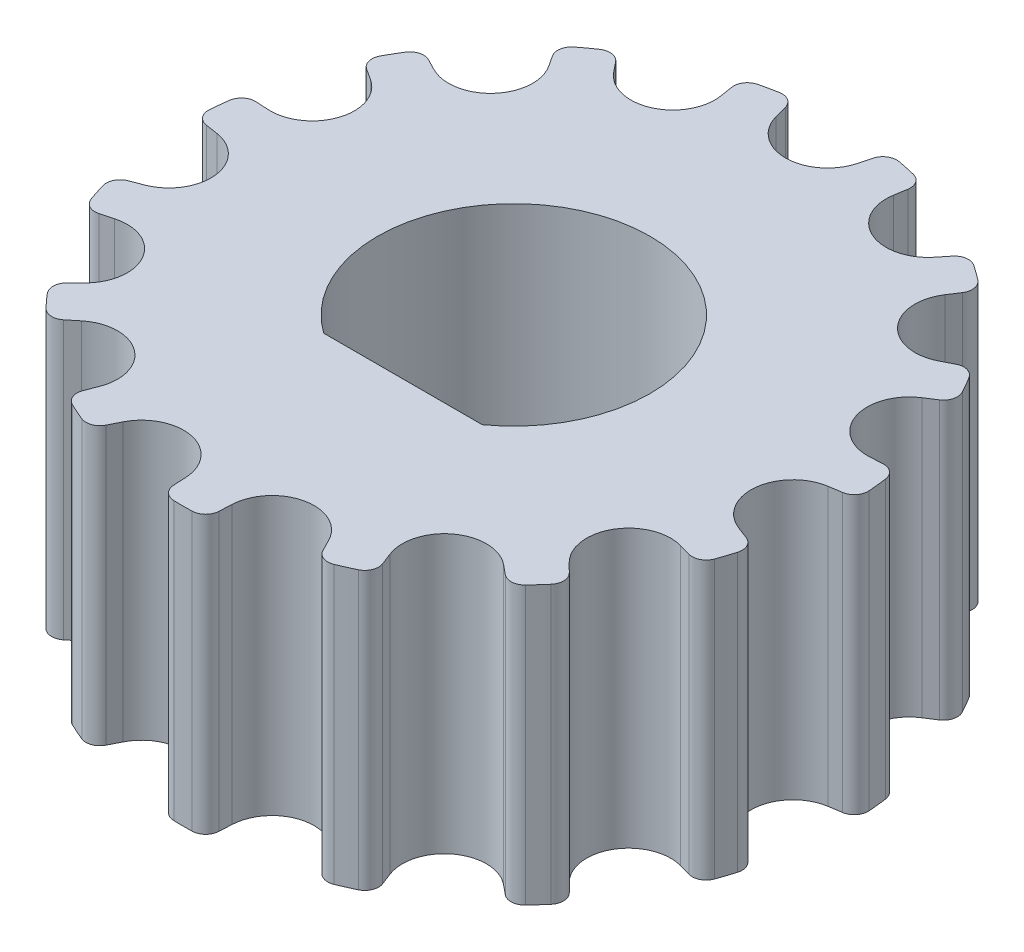
from build123d import *

# Parameters (mm, degrees)
SKETCH1_R           = 7.161972439
BOSS_EXTRUDE1_DEPTH = 6
CUT_EXTRUDE1_DEPTH  = 12.772327656
CIRPATTERN1_COUNT   = 15
CUT_EXTRUDE2_DEPTH  = 12.75997065


with BuildPart() as part:
    # Sketch1 → Boss-Extrude1 (new body)
    with BuildSketch(Plane(origin=(0, 0, 0), x_dir=(1, 0, 0), z_dir=(0, 1, 0))):
        Circle(SKETCH1_R)
    extrude(amount=BOSS_EXTRUDE1_DEPTH)

    # Sketch2 → Cut-Extrude1 (cut, through all)
    with BuildSketch(Plane(origin=(0, 6, 0), x_dir=(1, 0, 0), z_dir=(0, 1, 0))):
        with BuildLine():
            Line((-0.879885324, 6.559804793), (-0.95, 6.825530337))
            ThreePointArc((-0.95, 6.825530337), (-1.079308013, 7.002279754), (-1.294287054, 7.044052118))
            ThreePointArc((-1.294287054, 7.044052118), (-2.118539526, 6.841464719), (-2.913036628, 6.54278739))
            Line((-2.913036628, 6.54278739), (-2.913036628, 7.161972439))
            Line((-2.913036628, 7.161972439), (2.913036628, 7.161972439))
            Line((2.913036628, 7.161972439), (2.913036628, 6.54278739))
            ThreePointArc((2.913036628, 6.54278739), (2.118539526, 6.841464719), (1.294287054, 7.044052118))
            ThreePointArc((1.294287054, 7.044052118), (1.079308013, 7.002279754), (0.95, 6.825530337))
            Line((0.95, 6.825530337), (0.879885324, 6.559804793))
            ThreePointArc((0.879885324, 6.559804793), (0, 5.881972439), (-0.879885324, 6.559804793))
        make_face()
    cut_extrude1 = extrude(amount=-CUT_EXTRUDE1_DEPTH, mode=Mode.SUBTRACT)

    # CirPattern1: Cut-Extrude1 ×15 about axis
    cirpattern1_axis = Axis((0, 6, 0), (0, -1, 0))
    for i in range(1, CIRPATTERN1_COUNT):
        add(cut_extrude1.rotate(cirpattern1_axis, i * 360 / CIRPATTERN1_COUNT), mode=Mode.SUBTRACT)

    # Sketch3 → Cut-Extrude2 (cut, through all)
    with BuildSketch(Plane.XZ):
        with BuildLine():
            Line((1.71537168, 2.4), (-1.71537168, 2.4))
            ThreePointArc((-1.71537168, 2.4), (0, -2.95), (1.71537168, 2.4))
        make_face()
    extrude(amount=-CUT_EXTRUDE2_DEPTH, mode=Mode.SUBTRACT)


solid = part.part
